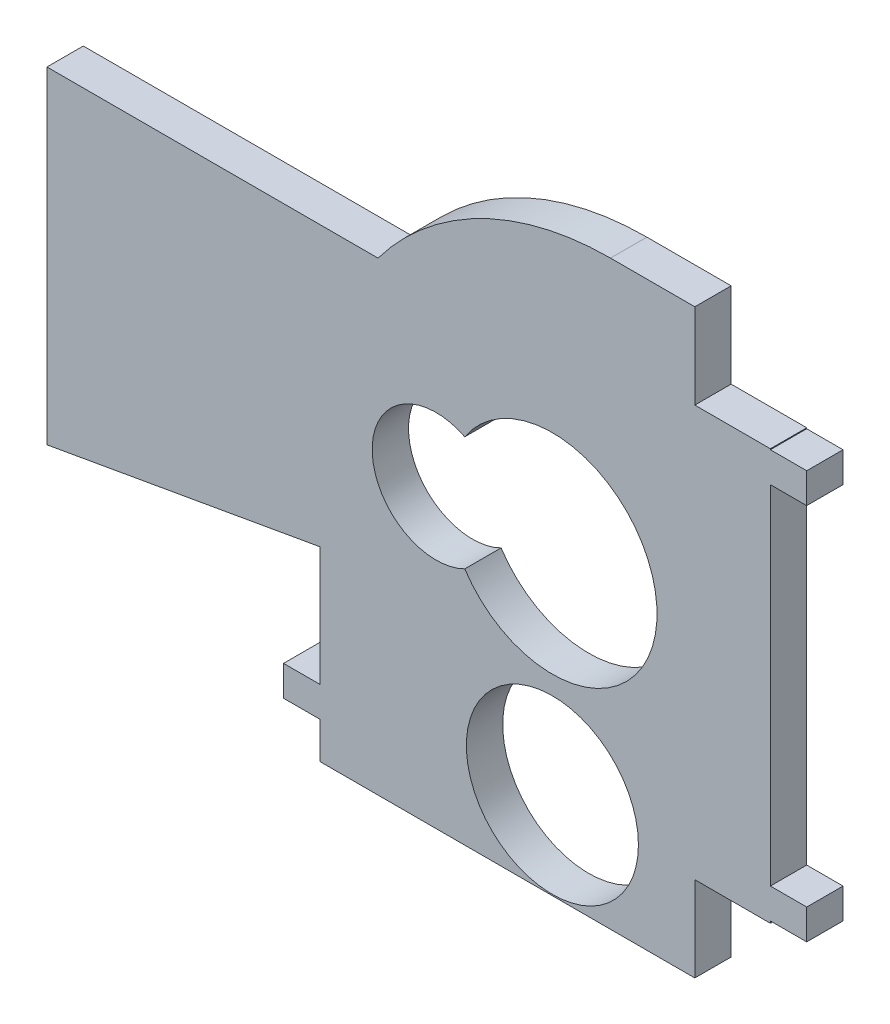
from build123d import *

# Parameters (mm, degrees)
SKETCH1_R           = 3.7592
BOSS_EXTRUDE1_DEPTH = 1.5875
CUT_EXTRUDE1_REACH  = 32.926
SKETCH2_W           = 3.302
SKETCH2_H           = 3.7211


with BuildPart() as part:
    # Sketch1 → Boss-Extrude1 (new body)
    with BuildSketch(Plane.XY):
        with BuildLine():
            Line((11.1125, 17.8308), (9.525, 17.8308))
            Line((9.525, 17.8308), (9.525, 21.59))
            Line((9.525, 21.59), (2.54, 21.59))
            ThreePointArc((2.54, 21.59), (-3.139612663, 20.249225326), (-7.62, 16.51))
            Line((-7.62, 16.51), (-22.084921519, 16.51))
            Line((-22.084921519, 16.51), (-22.084921519, 2.212007412))
            Line((-22.084921519, 2.212007412), (-10.16, 4.318))
            Line((-10.16, 4.318), (-10.16, -0.889))
            Line((-10.16, -0.889), (-11.7475, -0.889))
            Line((-11.7475, -0.889), (-11.7475, -2.2098))
            Line((-11.7475, -2.2098), (-10.16, -2.2098))
            Line((-10.16, -2.2098), (-10.16, -3.81))
            Line((-10.16, -3.81), (9.525, -3.81))
            Line((9.525, -3.81), (9.525, 0))
            Line((9.525, 0), (11.1125, 0))
            Line((11.1125, 0), (11.1125, 1.3208))
            Line((11.1125, 1.3208), (9.525, 1.3208))
            Line((9.525, 1.3208), (9.525, 16.51))
            Line((9.525, 16.51), (11.1125, 16.51))
            Line((11.1125, 16.51), (11.1125, 17.8308))
        make_face()
        with BuildLine():
            ThreePointArc((-3.82905, 6.645688551), (-7.874, 9.144), (-3.82905, 11.642311449))
            ThreePointArc((-3.82905, 11.642311449), (4.572, 9.144), (-3.82905, 6.645688551))
        make_face(mode=Mode.SUBTRACT)
        Circle(SKETCH1_R, mode=Mode.SUBTRACT)
    extrude(amount=BOSS_EXTRUDE1_DEPTH)

    # Sketch2 → Cut-Extrude1 (cut, up to next)
    with BuildSketch(Plane.XY.offset(1.5875), mode=Mode.PRIVATE) as cut_extrude1_sk1:
        with Locations((7.874, -1.94945)):
            Rectangle(SKETCH2_W, SKETCH2_H)
    cut_extrude1_tool1 = extrude(cut_extrude1_sk1.sketch, amount=-CUT_EXTRUDE1_REACH, mode=Mode.PRIVATE) & part.part
    # Sketch2 → Cut-Extrude1 (cut, up to next)
    with BuildSketch(Plane.XY.offset(1.5875), mode=Mode.PRIVATE) as cut_extrude1_sk2:
        with Locations((7.874, 19.72945)):
            Rectangle(SKETCH2_W, SKETCH2_H)
    cut_extrude1_tool2 = extrude(cut_extrude1_sk2.sketch, amount=-CUT_EXTRUDE1_REACH, mode=Mode.PRIVATE) & part.part
    add(cut_extrude1_tool1.solids().sort_by_distance((7.874, -1.94945, 1.5875))[0], mode=Mode.SUBTRACT)
    add(cut_extrude1_tool2.solids().sort_by_distance((7.874, 19.72945, 1.5875))[0], mode=Mode.SUBTRACT)


solid = part.part
